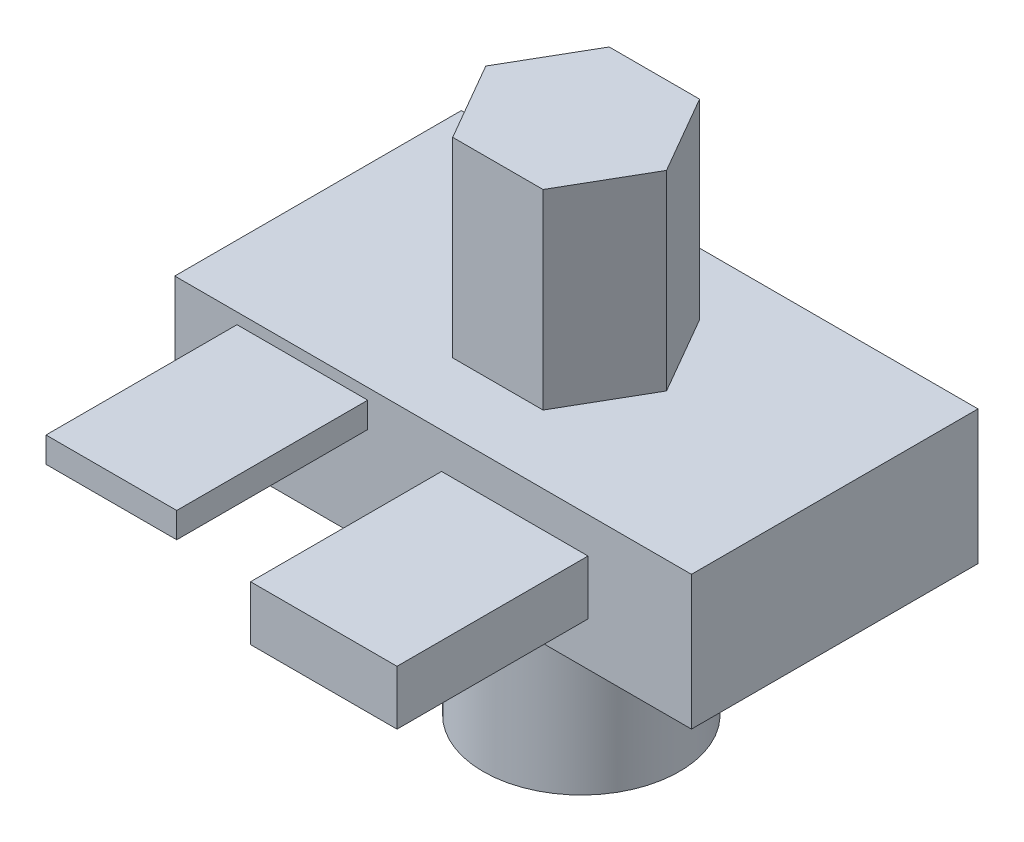
from build123d import *

# Parameters (mm, degrees)
SKETCH1_W           = 137.407001984
SKETCH1_H           = 35.641957088
BOSS_EXTRUDE1_DEPTH = 76.2
BOSS_EXTRUDE2_DEPTH = 50.8
SKETCH3_R           = 26.099786647
BOSS_EXTRUDE3_DEPTH = 50.8
SKETCH4_W           = 34.762618313
SKETCH4_H           = 6.759398006
SKETCH4_W_2         = 38.947007555
SKETCH4_H_2         = 14.484424297
BOSS_EXTRUDE4_DEPTH = 50.8
FILLET1_R           = 2.54


with BuildPart() as part:
    # Sketch1 → Boss-Extrude1 (new body)
    with BuildSketch(Plane.XY):
        Rectangle(SKETCH1_W, SKETCH1_H)
    extrude(amount=BOSS_EXTRUDE1_DEPTH)

    # Sketch2 → Boss-Extrude2 (add)
    with BuildSketch(Plane(origin=(0, 17.820978544, 0), x_dir=(1, 0, 0), z_dir=(0, 1, 0))):
        Polygon((23.159003861, -37.290679973), (11.143714224, -16.479587852), (-12.886865052, -16.479587852), (-24.90215469, -37.290679973), (-12.886865052, -58.101772093), (11.143714224, -58.101772093), align=None)
    extrude(amount=BOSS_EXTRUDE2_DEPTH)

    # Sketch3 → Boss-Extrude3 (add)
    with BuildSketch(Plane.XZ.offset(17.820978544)):
        with Locations((0, 36.792636879)):
            Circle(SKETCH3_R)
    extrude(amount=BOSS_EXTRUDE3_DEPTH)

    # Sketch4 → Boss-Extrude4 (add)
    with BuildSketch(Plane.XY.offset(76.2)):
        with Locations((-34.762618313, 11.507070414)):
            Rectangle(SKETCH4_W, SKETCH4_H)
        with Locations((21.726636446, 1.04609731)):
            Rectangle(SKETCH4_W_2, SKETCH4_H_2)
    extrude(amount=BOSS_EXTRUDE4_DEPTH)

    # Fillet1
    fillet1_edges = [part.edges().sort_by_distance(p)[0] for p in [
        (-26.099786647, -17.820978544, 36.792636879),
    ]]
    fillet(fillet1_edges, radius=FILLET1_R)


solid = part.part
